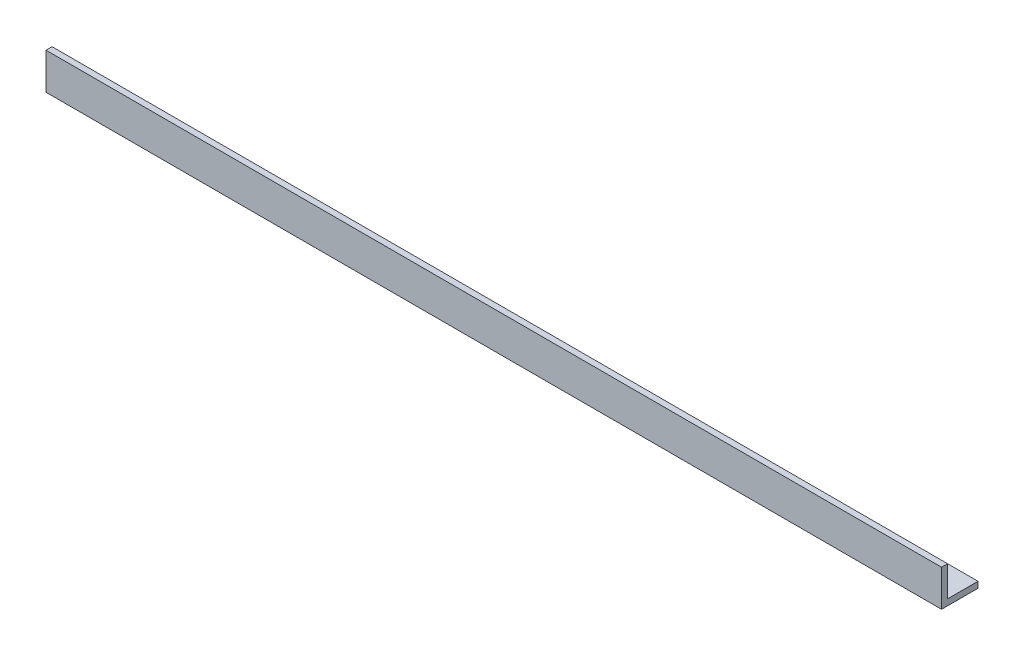
from build123d import *

# Parameters (mm, degrees)
BOSS_EXTRUDE1_DEPTH = 468
SKETCH2_R           = 6
CUT_EXTRUDE1_DEPTH  = 3.175


with BuildPart() as part:
    # Sketch1 → Boss-Extrude1 (new body)
    with BuildSketch(Plane(origin=(0, 0, 0), x_dir=(0, 0, -1), z_dir=(1, 0, 0))):
        Polygon((0, 0), (0, 19.05), (3.175, 19.05), (3.175, 3.175), (19.05, 3.175), (19.05, 0), align=None)
    extrude(amount=-BOSS_EXTRUDE1_DEPTH)

    # Sketch2 → Cut-Extrude1 (cut)
    with BuildSketch(Plane(origin=(0, 3.175, 0), x_dir=(1, 0, 0), z_dir=(0, 1, 0))):
        with Locations((-21.13, 11.273546723)):
            Circle(SKETCH2_R)
        with Locations((-56.88, 11.273546723)):
            Circle(SKETCH2_R)
        with Locations((-92.63, 11.273546723)):
            Circle(SKETCH2_R)
        with Locations((-128.38, 11.273546723)):
            Circle(SKETCH2_R)
        with Locations((-164.13, 11.273546723)):
            Circle(SKETCH2_R)
        with Locations((-199.88, 11.273546723)):
            Circle(SKETCH2_R)
        with Locations((-235.63, 11.273546723)):
            Circle(SKETCH2_R)
        with Locations((-271.38, 11.273546723)):
            Circle(SKETCH2_R)
        with Locations((-307.13, 11.273546723)):
            Circle(SKETCH2_R)
        with Locations((-342.88, 11.273546723)):
            Circle(SKETCH2_R)
        with Locations((-378.63, 11.273546723)):
            Circle(SKETCH2_R)
        with Locations((-414.38, 11.273546723)):
            Circle(SKETCH2_R)
        with Locations((-450.13, 11.273546723)):
            Circle(SKETCH2_R)
    extrude(amount=-CUT_EXTRUDE1_DEPTH, mode=Mode.SUBTRACT)


solid = part.part
